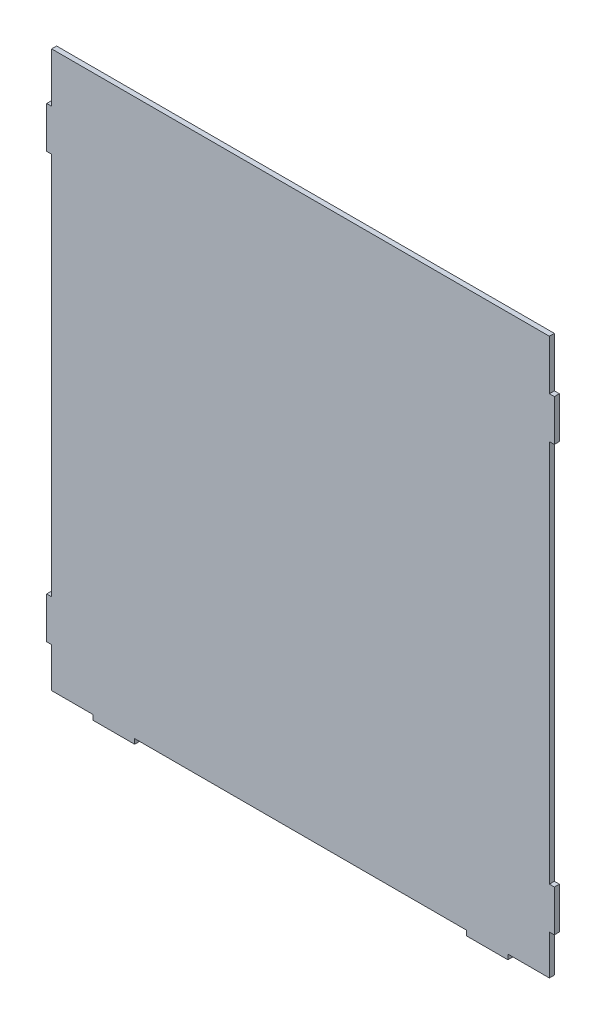
from build123d import *

# Parameters (mm, degrees)
BOSS_EXTRUDE1_DEPTH = 6


with BuildPart() as part:
    # Sketch1 → Boss-Extrude1 (new body)
    with BuildSketch(Plane.XY):
        Polygon((-293.97527456, 322.56844283), (306.02472544, 322.56844283), (306.02472544, 262.56844283), (312.02472544, 262.56844283), (312.02472544, 212.56844283), (306.02472544, 212.56844283), (306.02472544, -249.43155717), (312.02472544, -249.43155717), (312.02472544, -299.43155717), (306.02472544, -299.43155717), (306.02472544, -347.43155717), (256.02472544, -347.43155717), (256.02472544, -353.43155717), (206.02472544, -353.43155717), (206.02472544, -347.43155717), (-193.97527456, -347.43155717), (-193.97527456, -353.43155717), (-243.97527456, -353.43155717), (-243.97527456, -347.43155717), (-293.97527456, -347.43155717), (-293.97527456, -299.43155717), (-299.97527456, -299.43155717), (-299.97527456, -249.43155717), (-293.97527456, -249.43155717), (-293.97527456, 212.56844283), (-299.97527456, 212.56844283), (-299.97527456, 262.56844283), (-293.97527456, 262.56844283), align=None)
    extrude(amount=BOSS_EXTRUDE1_DEPTH)


solid = part.part
